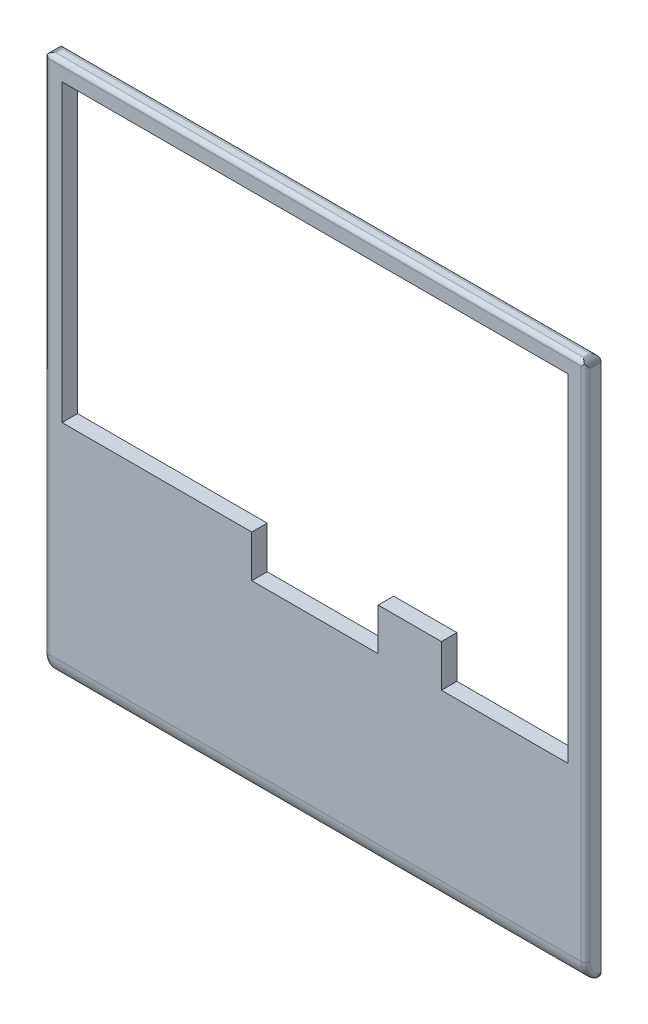
from build123d import *

# Parameters (mm, degrees)
EXTRUDE_1_DEPTH     = 7
FILLET_2_R          = 10
FILLET_4_R          = 2
SKETCH_2_R          = 1.45
CUT_EXTRUDE_1_DEPTH = 3


with BuildPart() as part:
    # Model → 凸台-拉伸1 (new body)
    with BuildSketch(Plane.XY):
        Polygon((241.697, 244.733), (241.931, 244.723), (242.165, 244.697), (242.397, 244.65), (242.623, 244.586), (242.845, 244.504), (243.057, 244.406), (243.264, 244.29), (243.459, 244.161), (243.644, 244.015), (243.818, 243.855), (243.978, 243.681), (244.124, 243.497), (244.253, 243.301), (244.369, 243.094), (244.468, 242.88), (244.549, 242.66), (244.613, 242.433), (244.66, 242.203), (244.686, 241.969), (244.697, 241.733), (244.697, 3.1309), (244.686, 2.89664), (244.66, 2.66237), (244.613, 2.43086), (244.549, 2.20486), (244.468, 1.983), (244.369, 1.77078), (244.253, 1.56407), (244.124, 1.36839), (243.978, 1.18374), (243.818, 1.0101), (243.644, 0.850251), (243.459, 0.704176), (243.264, 0.574643), (243.057, 0.458886), (242.845, 0.359668), (242.623, 0.278364), (242.397, 0.214974), (242.165, 0.168121), (241.931, 0.141938), (241.697, 0.130914), (3.09507, 0.130914), (2.85943, 0.141938), (2.62516, 0.168121), (2.39503, 0.214974), (2.16765, 0.278364), (1.94717, 0.359668), (1.73357, 0.458886), (1.52687, 0.574643), (1.33119, 0.704176), (1.14653, 0.850251), (0.972894, 1.0101), (0.813043, 1.18374), (0.666972, 1.36839), (0.537436, 1.56407), (0.421679, 1.77078), (0.323839, 1.983), (0.241157, 2.20486), (0.177767, 2.43086), (0.130914, 2.66237), (0.104731, 2.89664), (0.0950846, 3.13228), (0.0950846, 241.733), (0.104731, 241.969), (0.130914, 242.203), (0.177767, 242.433), (0.241157, 242.66), (0.323839, 242.88), (0.421679, 243.094), (0.537436, 243.301), (0.666972, 243.497), (0.813043, 243.681), (0.972894, 243.855), (1.14653, 244.015), (1.33119, 244.161), (1.52687, 244.29), (1.73357, 244.406), (1.94717, 244.504), (2.16765, 244.586), (2.39503, 244.65), (2.62516, 244.697), (2.85943, 244.723), (3.09507, 244.733), align=None)
        Polygon((8.09322, 236.735), (8.09322, 103.382), (93.8195, 103.382), (93.8195, 84.3319), (150.971, 84.3319), (150.971, 103.382), (179.544, 103.382), (179.544, 84.3319), (236.696, 84.3319), (236.696, 236.735), align=None, mode=Mode.SUBTRACT)
    extrude(amount=EXTRUDE_1_DEPTH)

    # 圆角2
    # the kernel refuses this fillet: 10 mm, written as the material it takes off along each edge
    with BuildSketch(Plane(origin=(265.545480035, 0.130914, 7), x_dir=(0, 0, -1), z_dir=(-1, 0, 0))) as fillet_2_piece_1:
        with BuildLine():
            CenterArc((10, -9.539392014), FILLET_2_R, 107.457603124, 72.542396876)
            Line((0, -9.539392014), (-0.2, -9.539392014))
            Line((-0.2, -9.539392014), (-0.2, 0))
            Line((-0.2, 0), (0, 0.2))
            ThreePointArc((0, 0.2), (3.5, 0.2), (6.94, 0.19078784))
            Line((6.94, 0.19078784), (7, 0))
        make_face()
    extrude(amount=286.298890071, mode=Mode.SUBTRACT)

    # 圆角4
    # the kernel refuses this fillet: 2 mm, written as the material it takes off along each edge
    with BuildSketch(Plane(origin=(244.697, 9.670306014, -3), x_dir=(0, 0, 1), z_dir=(0, 1, 0))) as fillet_4_piece_1:
        with BuildLine():
            CenterArc((10 - FILLET_4_R, -FILLET_4_R), FILLET_4_R, 0, 90)
            Line((10, -FILLET_4_R), (10, 0))
            Line((10, 0), (10 - FILLET_4_R, 0))
        make_face()
    revolve(axis=Axis((244.697, 9.670306014, -3), (1, 0, 0)), revolution_arc=69.48962831, mode=Mode.SUBTRACT)
    with BuildSketch(Plane(origin=(0.0950846, 9.670306014, -3), x_dir=(0, 0, 1), z_dir=(0, 1, 0))) as fillet_4_piece_2:
        with BuildLine():
            CenterArc((10 - FILLET_4_R, FILLET_4_R), FILLET_4_R, 270, 90)
            Line((10 - FILLET_4_R, 0), (10, 0))
            Line((10, 0), (10, FILLET_4_R))
        make_face()
    revolve(axis=Axis((0.0950846, 9.670306014, -3), (1, 0, 0)), revolution_arc=69.479176715, mode=Mode.SUBTRACT)
    with BuildSketch(Plane(origin=(241.697, 244.733, -0.106788872), x_dir=(0.9990881069030422, -0.04269607294465407, 0), z_dir=(0, 0, 1))) as fillet_4_piece_3:
        with BuildLine():
            CenterArc((FILLET_4_R * 0.0213577744759, -FILLET_4_R), FILLET_4_R, 90, 2.447048642)
            Line((-FILLET_4_R * 0.0213382984687, -FILLET_4_R * 0.000911893096955), (0, 0))
            Line((0, 0), (FILLET_4_R * 0.0213577744758, 0))
        make_face()
    extrude(amount=7.213577745, mode=Mode.SUBTRACT)
    with BuildSketch(Plane(origin=(-1.90493, 244.733, 7), x_dir=(0, 0, -1), z_dir=(1, 0, 0))) as fillet_4_piece_4:
        with BuildLine():
            CenterArc((FILLET_4_R, -FILLET_4_R), FILLET_4_R, 90, 90)
            Line((0, -FILLET_4_R), (0, 0))
            Line((0, 0), (FILLET_4_R, 0))
        make_face()
    extrude(amount=248.60193, mode=Mode.SUBTRACT)
    with BuildSketch(Plane(origin=(3.09507, 244.733, -0.106046317), x_dir=(1, 0, 0), z_dir=(0, 0, 1))) as fillet_4_piece_5:
        with BuildLine():
            CenterArc((FILLET_4_R * 0.0212092634346, -FILLET_4_R), FILLET_4_R, 90, 2.430038236)
            Line((-FILLET_4_R * 0.021190190767, -FILLET_4_R * 0.000899261193638), (0, 0))
            Line((0, 0), (FILLET_4_R * 0.0212092634346, 0))
        make_face()
    extrude(amount=7.212092634, mode=Mode.SUBTRACT)
    with BuildSketch(Plane(origin=(-1.90493, 244.733, 0), x_dir=(0, 0, 1), z_dir=(1, 0, 0))) as fillet_4_piece_6:
        with BuildLine():
            CenterArc((FILLET_4_R, FILLET_4_R), FILLET_4_R, 180, 90)
            Line((0, FILLET_4_R), (0, 0))
            Line((0, 0), (FILLET_4_R, 0))
        make_face()
    extrude(amount=248.60193, mode=Mode.SUBTRACT)
    with BuildSketch(Plane(origin=(244.697, 246.733, 7), x_dir=(-1, 0, 0), z_dir=(0, -1, 0)), Plane(origin=(0.0950846, 9.670306014, 7), x_dir=(1, 0, 0), z_dir=(0, 1, 0))) as fillet_4_piece_7:
        with BuildLine():
            CenterArc((FILLET_4_R, FILLET_4_R), FILLET_4_R, 180, 90)
            Line((0, FILLET_4_R), (0, 0))
            Line((0, 0), (FILLET_4_R, 0))
        make_face()
    extrude(amount=237.062693986, mode=Mode.SUBTRACT)

    # 草图2 → 切除-拉伸1 (cut)
    with BuildSketch(Plane(origin=(0, 0, 0), x_dir=(-1, 0, 0), z_dir=(0, 0, -1))):
        with Locations((-240.697, 4.13135)):
            Circle(SKETCH_2_R)
        with Locations((-161.833533259, 4.13135)):
            Circle(SKETCH_2_R)
        with Locations((-82.96205, 4.13135)):
            Circle(SKETCH_2_R)
        with Locations((-4.094835, 4.13135)):
            Circle(SKETCH_2_R)
        with Locations((-4.094835, 82.9991)):
            Circle(SKETCH_2_R)
        with Locations((-4.094835, 161.866)):
            Circle(SKETCH_2_R)
        with Locations((-4.094835, 240.734)):
            Circle(SKETCH_2_R)
        with Locations((-82.96205, 240.732)):
            Circle(SKETCH_2_R)
        with Locations((-161.83, 240.732)):
            Circle(SKETCH_2_R)
        with Locations((-240.697, 240.732)):
            Circle(SKETCH_2_R)
        with Locations((-240.697, 161.866)):
            Circle(SKETCH_2_R)
        with Locations((-240.697, 82.998)):
            Circle(SKETCH_2_R)
    extrude(amount=-CUT_EXTRUDE_1_DEPTH, mode=Mode.SUBTRACT)


solid = part.part
